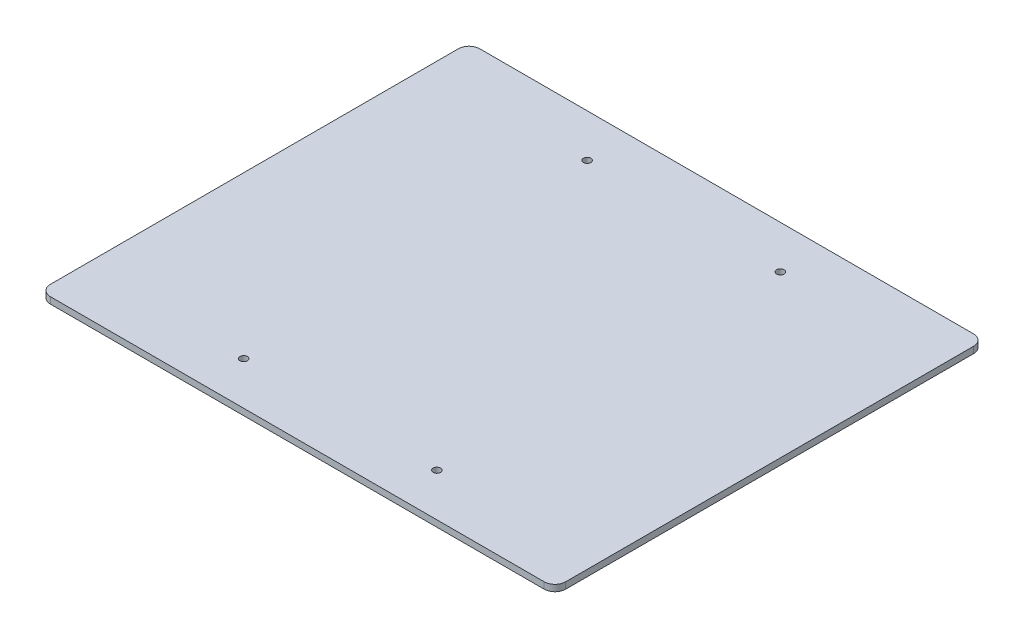
from build123d import *

# Parameters (mm, degrees)
SKETCH_1_W          = 240
SKETCH_1_H          = 200
EXTRUDE_1_DEPTH     = 3
FILLET_1_R          = 5
SKETCH_2_R          = 1.75
CUT_EXTRUDE_1_DEPTH = 18


with BuildPart() as part:
    # 草图1 → 凸台-拉伸1 (new body)
    with BuildSketch(Plane(origin=(0, 0, 0), x_dir=(1, 0, 0), z_dir=(0, 1, 0))):
        Rectangle(SKETCH_1_W, SKETCH_1_H)
    extrude(amount=EXTRUDE_1_DEPTH)

    # 圆角1
    fillet_1_edges = [part.edges().sort_by_distance(p)[0] for p in [
        (-120, 1.5, 100),
        (-120, 1.5, -100),
        (120, 1.5, 100),
        (120, 1.5, -100),
    ]]
    fillet(fillet_1_edges, radius=FILLET_1_R)

    # 草图2 → 切除-拉伸1 (cut)
    with BuildSketch(Plane.XZ):
        with Locations((-45, 80)):
            Circle(SKETCH_2_R)
        with Locations((45, 80)):
            Circle(SKETCH_2_R)
        with Locations((45, -80)):
            Circle(SKETCH_2_R)
        with Locations((-45, -80)):
            Circle(SKETCH_2_R)
    extrude(amount=-CUT_EXTRUDE_1_DEPTH, mode=Mode.SUBTRACT)


solid = part.part
